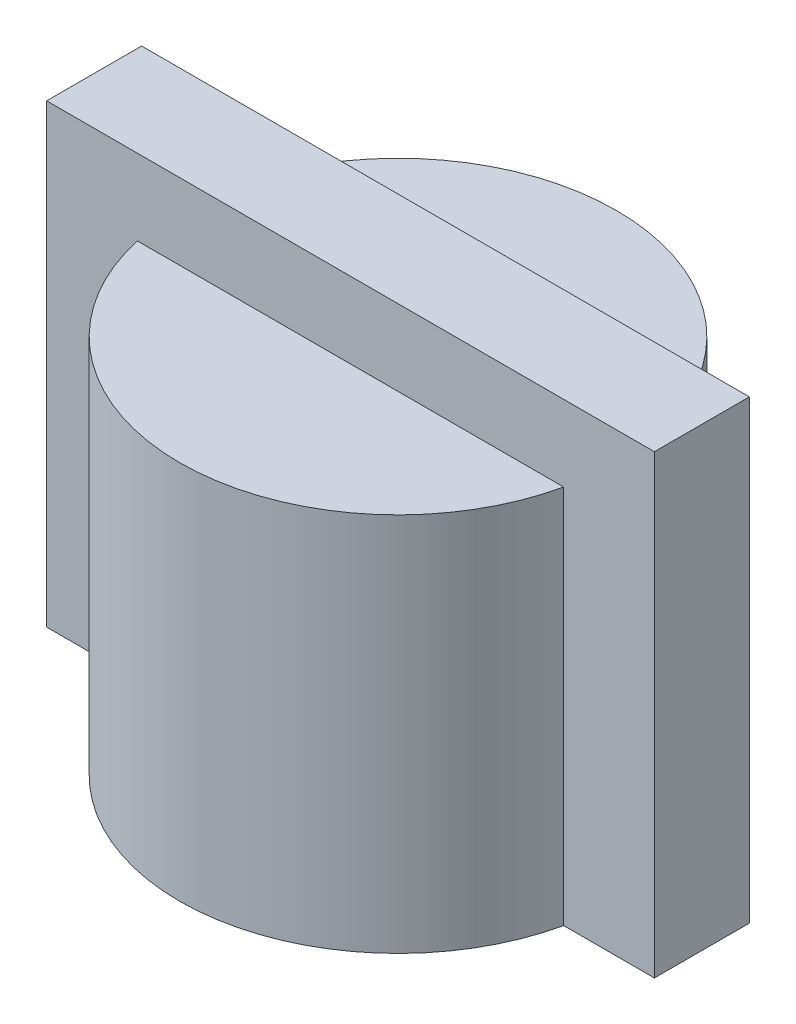
from build123d import *

# Parameters (mm, degrees)
SKETCH1_R           = 5.75
BOSS_EXTRUDE1_DEPTH = 10
SKETCH2_W           = 16
SKETCH2_H           = 2.5
BOSS_EXTRUDE2_DEPTH = 12


with BuildPart() as part:
    # Sketch1 → Boss-Extrude1 (new body)
    with BuildSketch(Plane(origin=(0, 0, 0), x_dir=(1, 0, 0), z_dir=(0, 1, 0))):
        Circle(SKETCH1_R)
    extrude(amount=BOSS_EXTRUDE1_DEPTH)

    # Sketch2 → Boss-Extrude2 (add)
    with BuildSketch(Plane(origin=(0, 0, 0), x_dir=(-1, 0, 0), z_dir=(0, -1, 0))):
        Rectangle(SKETCH2_W, SKETCH2_H)
    extrude(amount=-BOSS_EXTRUDE2_DEPTH)


solid = part.part
